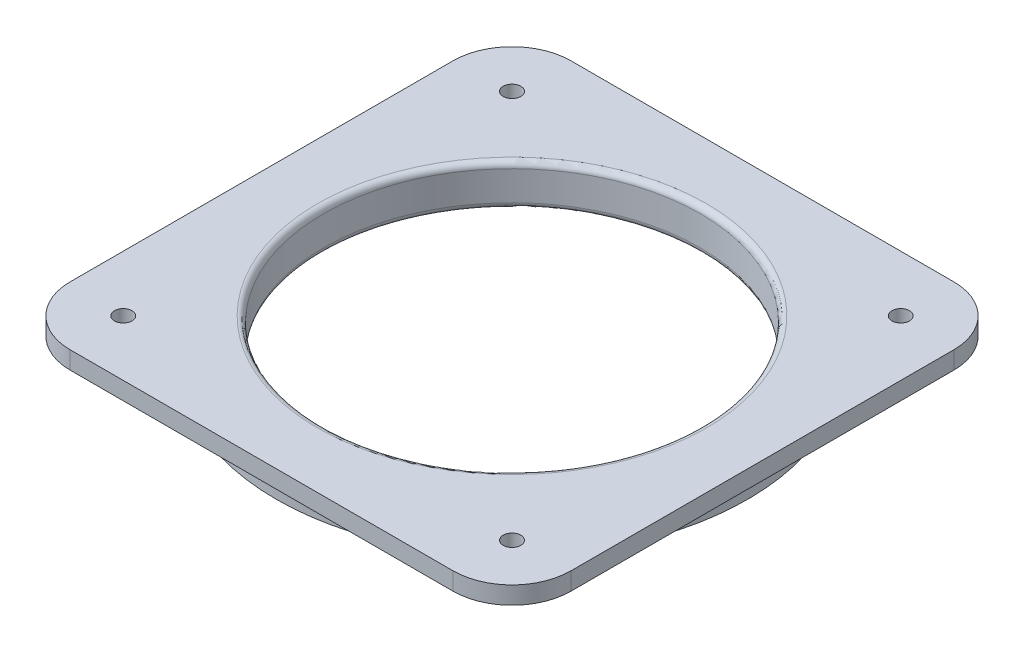
from build123d import *

# Parameters (mm, degrees)
ESBO_O1_W                = 85
ESBO_O1_H                = 85
RESSALTO_EXTRUS_O1_DEPTH = 3
ESBO_O2_W                = 40
ESBO_O2_H                = 4
FURO_COM_FOLGA_DE_M521_D = 64
FILETE1_R                = 1
FILETE2_R                = 10
ESBO_O5_R                = 1.5
CORTE_EXTRUS_O1_DEPTH    = 10
FILETE3_R                = 0.5


with BuildPart() as part:
    # Esboço1 → Ressalto-extrusão1 (new body)
    with BuildSketch(Plane.XZ.offset(3)):
        Rectangle(ESBO_O1_W, ESBO_O1_H)
    extrude(amount=-RESSALTO_EXTRUS_O1_DEPTH)

    # Esboço2 → Revolução1 (revolve)
    with BuildSketch(Plane(origin=(0, 0, 0), x_dir=(-1, 0, 0), z_dir=(0, 0, -1))):
        with Locations((-20, -5)):
            Rectangle(ESBO_O2_W, ESBO_O2_H)
    revolve(axis=Axis((0, -7, 0), (0, 1, 0)))

    # Furo com folga de M521 (through all)
    with Locations(Plane(origin=(0, 0, 0), x_dir=(1, 0, 0), z_dir=(0, 1, 0))):
        with Locations((0, 0)):
            Hole(FURO_COM_FOLGA_DE_M521_D / 2)

    # Filete1
    filete1_edges = [part.edges().sort_by_distance(p)[0] for p in [
        (32, 0, 0),
        (32, -7, 0),
    ]]
    fillet(filete1_edges, radius=FILETE1_R)

    # Filete2
    filete2_edges = [part.edges().sort_by_distance(p)[0] for p in [
        (-42.5, -1.5, 42.5),
        (42.5, -1.5, 42.5),
        (-42.5, -1.5, -42.5),
        (42.5, -1.5, -42.5),
    ]]
    fillet(filete2_edges, radius=FILETE2_R)

    # Esboço5 → Corte-extrusão1 (cut)
    with BuildSketch(Plane.XZ.offset(3)):
        with Locations((33, 33)):
            Circle(ESBO_O5_R)
        with Locations((33, -33)):
            Circle(ESBO_O5_R)
        with Locations((-33, 33)):
            Circle(ESBO_O5_R)
        with Locations((-33, -33)):
            Circle(ESBO_O5_R)
    extrude(amount=-CORTE_EXTRUS_O1_DEPTH, mode=Mode.SUBTRACT)

    # Filete3
    filete3_edges = [part.edges().sort_by_distance(p)[0] for p in [
        (-34.5, -3, 33),
        (-34.5, -3, -33),
        (31.5, -3, -33),
        (31.5, -3, 33),
    ]]
    fillet(filete3_edges, radius=FILETE3_R)


solid = part.part
